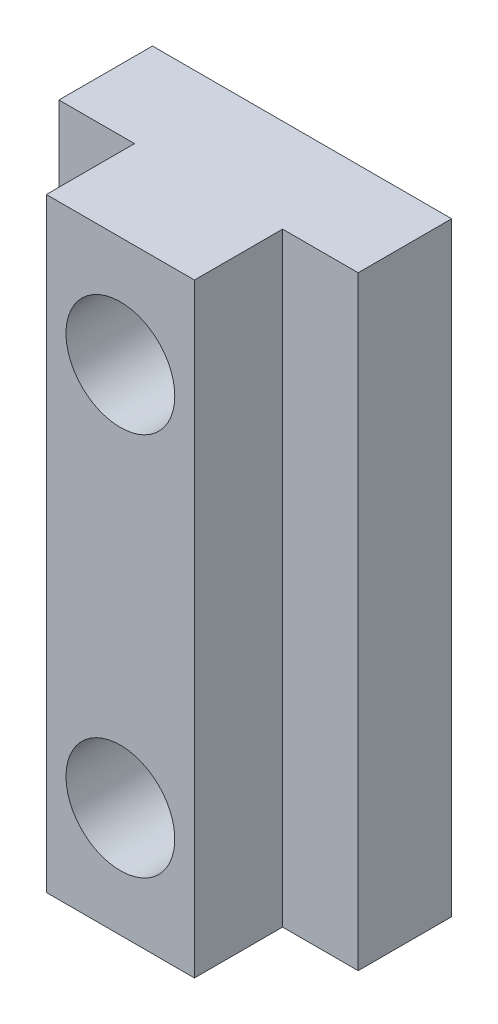
from build123d import *

# Parameters (mm, degrees)
BOSS_EXTRUDE2_DEPTH = 20
SKETCH5_R           = 1.8
CUT_EXTRUDE1_DEPTH  = 4
SKETCH6_R           = 1.25
CUT_EXTRUDE2_DEPTH  = 990.353021007


with BuildPart() as part:
    # Sketch4 → Boss-Extrude2 (new body)
    with BuildSketch(Plane(origin=(530.949030192, 814.662469053, 1536.164312915), x_dir=(1, 0, 0), z_dir=(0, 1, 0))):
        Polygon((-9.678659284, -55.915046155), (0.221340716, -55.915046155), (0.221340716, -59.008959957), (-2.278659284, -59.008959957), (-2.278659284, -61.926235265), (-7.178659284, -61.926235265), (-7.178659284, -59.008959957), (-9.678659284, -59.008959957), align=None)
    extrude(amount=BOSS_EXTRUDE2_DEPTH)

    # Sketch5 → Cut-Extrude1 (cut)
    with BuildSketch(Plane.XY.offset(1598.09054818)):
        with Locations((526.220370908, 831.012469053)):
            Circle(SKETCH5_R)
        with Locations((526.220370908, 818.312469053)):
            Circle(SKETCH5_R)
    extrude(amount=-CUT_EXTRUDE1_DEPTH, mode=Mode.SUBTRACT)

    # Sketch6 → Cut-Extrude2 (cut, through all)
    with BuildSketch(Plane.XY.offset(1594.09054818)):
        with Locations((526.220370908, 831.012469053)):
            Circle(SKETCH6_R)
        with Locations((526.220370908, 818.312469053)):
            Circle(SKETCH6_R)
    extrude(amount=-CUT_EXTRUDE2_DEPTH, mode=Mode.SUBTRACT)


solid = part.part
